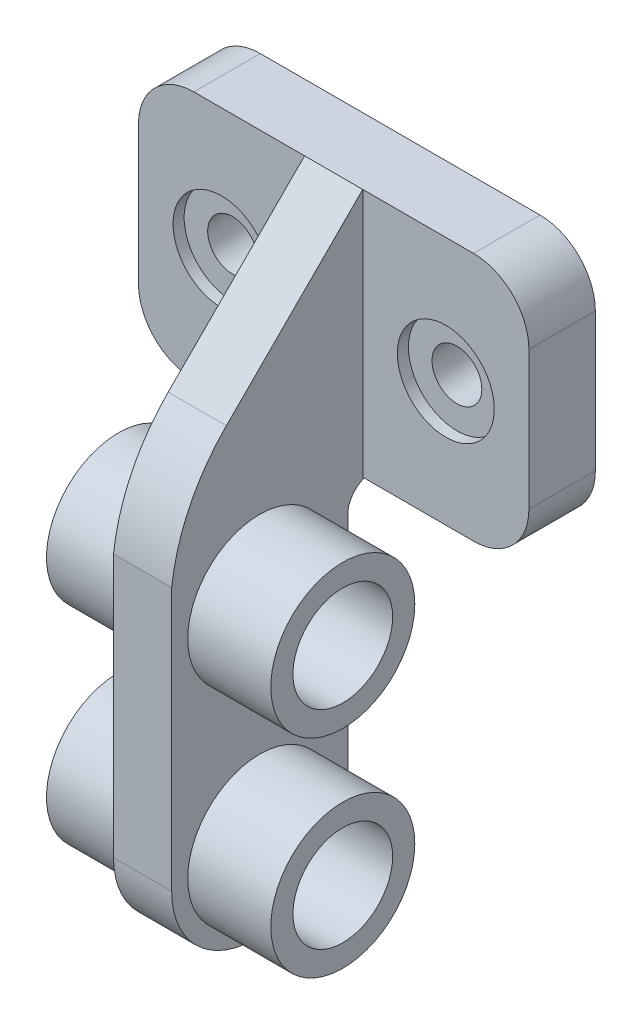
from build123d import *

# Parameters (mm, degrees)
CROQUIS2_W                   = 141
CROQUIS2_H                   = 90
SALIENTE_EXTRUIR1_DEPTH      = 24
REDONDEO1_R                  = 20
CROQUIS3_R                   = 17.5
CORTAR_EXTRUIR1_DEPTH        = 4
CROQUIS5_W                   = 21
CROQUIS5_H                   = 90
SALIENTE_EXTRUIR2_DEPTH      = 69
CHAFL_N1_SIZE                = 69
REDONDEO4_R                  = 69
CROQUIS10_W                  = 21
CROQUIS10_H                  = 63.589544636
SALIENTE_EXTRUIR6_DEPTH      = 125
REDONDEO6_R                  = 9
REDONDEO7_R                  = 30
SALIENTE_EXTRUIR8_DEPTH      = 30
SALIENTE_EXTRUIR8_DEPTH_BACK = 51
CROQUIS11_R                  = 26
CROQUIS15_R                  = 18
CORTAR_EXTRUIR3_DEPTH        = 224.315919719
CROQUIS16_R                  = 18
CORTAR_EXTRUIR4_DEPTH        = 224.315919719
CROQUIS17_R                  = 9
CORTAR_EXTRUIR5_DEPTH        = 30
CROQUIS18_R                  = 9
CORTAR_EXTRUIR6_DEPTH        = 30


with BuildPart() as part:
    # Croquis2 → Saliente-Extruir1 (new body)
    with BuildSketch(Plane.XY):
        Rectangle(CROQUIS2_W, CROQUIS2_H)
    extrude(amount=SALIENTE_EXTRUIR1_DEPTH)

    # Redondeo1
    redondeo1_edges = [part.edges().sort_by_distance(p)[0] for p in [
        (70.5, -45, 12),
        (-70.5, -45, 12),
        (-70.5, 45, 12),
        (70.5, 45, 12),
    ]]
    fillet(redondeo1_edges, radius=REDONDEO1_R)

    # Croquis3 → Cortar-Extruir1 (cut)
    with BuildSketch(Plane.XY.offset(24)):
        with Locations((-40.5, 0)):
            Circle(CROQUIS3_R)
        with Locations(Location((40.5, 0, 0), (0, 0, 180))):
            Circle(CROQUIS3_R)
    extrude(amount=-CORTAR_EXTRUIR1_DEPTH, mode=Mode.SUBTRACT)

    # Croquis5 → Saliente-Extruir2 (add)
    with BuildSketch(Plane.XY.offset(24)):
        Rectangle(CROQUIS5_W, CROQUIS5_H)
    extrude(amount=SALIENTE_EXTRUIR2_DEPTH)

    # Chaflán1
    chafl_n1_edges = [part.edges().sort_by_distance(p)[0] for p in [
        (0, 45, 93),
    ]]
    chamfer(chafl_n1_edges, length=CHAFL_N1_SIZE)

    # Redondeo4
    # the kernel refuses this fillet: 69 mm, written as the material it takes off along each edge
    with BuildSketch(Plane(origin=(-80.285016103, -24, 93), x_dir=(0, 0.7071067811865477, -0.7071067811865474), z_dir=(1, 0, 0))) as redondeo4_piece_1:
        with BuildLine():
            CenterArc((27.914006441, -69), REDONDEO4_R, 90, 38.298408264)
            Line((-14.849242405, -14.849242405), (-15.704507382, -13.766227253))
            ThreePointArc((-15.704507382, -13.766227253), (-8.40042856, -6.448813844), (-0.975807358, 0.975807358))
            Line((-0.975807358, 0.975807358), (0, 1.38))
            Line((0, 1.38), (27.914006441, 1.38))
            Line((27.914006441, 1.38), (27.914006441, 0))
        make_face()
    extrude(amount=160.570032206, mode=Mode.SUBTRACT)

    # Croquis10 → Saliente-Extruir6 (add)
    with BuildSketch(Plane(origin=(0, -45, 0), x_dir=(-1, 0, 0), z_dir=(0, -1, 0))):
        with Locations((0, -61.205227682)):
            Rectangle(CROQUIS10_W, CROQUIS10_H)
    extrude(amount=SALIENTE_EXTRUIR6_DEPTH)

    # Redondeo6
    # the kernel refuses this fillet: 9 mm, written as the material it adds along each edge
    with BuildSketch(Plane(origin=(-10.5, -45, 29.410455364), x_dir=(0, 0, -1), z_dir=(1, 0, 0))) as redondeo6_piece_1:
        with BuildLine():
            CenterArc((REDONDEO6_R, -REDONDEO6_R), REDONDEO6_R, 90, 90)
            Line((0, -REDONDEO6_R), (0, 0))
            Line((0, 0), (REDONDEO6_R, 0))
        make_face()
    extrude(amount=21)

    # Redondeo7
    redondeo7_edges = [part.edges().sort_by_distance(p)[0] for p in [
        (0, -170, 93),
        (0, -170, 29.410455364),
    ]]
    fillet(redondeo7_edges, radius=REDONDEO7_R)

    # Croquis11 → Saliente-Extruir8 (add, two sides: drawn at the far end of the back side and taken through both)
    with BuildSketch(Plane(origin=(10.5, 0, 0), x_dir=(0, 0, -1), z_dir=(1, 0, 0)).offset(-SALIENTE_EXTRUIR8_DEPTH_BACK)):
        with Locations((-61.205227682, -64)):
            Circle(CROQUIS11_R)
        with Locations((-61.205227682, -139)):
            Circle(CROQUIS11_R)
    extrude(amount=SALIENTE_EXTRUIR8_DEPTH + SALIENTE_EXTRUIR8_DEPTH_BACK)

    # Croquis15 → Cortar-Extruir3 (cut, through all)
    with BuildSketch(Plane(origin=(40.5, 0, 0), x_dir=(0, 0, -1), z_dir=(1, 0, 0))):
        with Locations((-61.205227682, -64)):
            Circle(CROQUIS15_R)
    extrude(amount=-CORTAR_EXTRUIR3_DEPTH, mode=Mode.SUBTRACT)

    # Croquis16 → Cortar-Extruir4 (cut, through all)
    with BuildSketch(Plane(origin=(40.5, 0, 0), x_dir=(0, 0, -1), z_dir=(1, 0, 0))):
        with Locations((-61.205227682, -139)):
            Circle(CROQUIS16_R)
    extrude(amount=-CORTAR_EXTRUIR4_DEPTH, mode=Mode.SUBTRACT)

    # Croquis17 → Cortar-Extruir5 (cut)
    with BuildSketch(Plane.XY.offset(20)):
        with Locations((40.5, 0)):
            Circle(CROQUIS17_R)
    extrude(amount=-CORTAR_EXTRUIR5_DEPTH, mode=Mode.SUBTRACT)

    # Croquis18 → Cortar-Extruir6 (cut)
    with BuildSketch(Plane.XY.offset(20)):
        with Locations((-40.5, 0)):
            Circle(CROQUIS18_R)
    extrude(amount=-CORTAR_EXTRUIR6_DEPTH, mode=Mode.SUBTRACT)


solid = part.part
